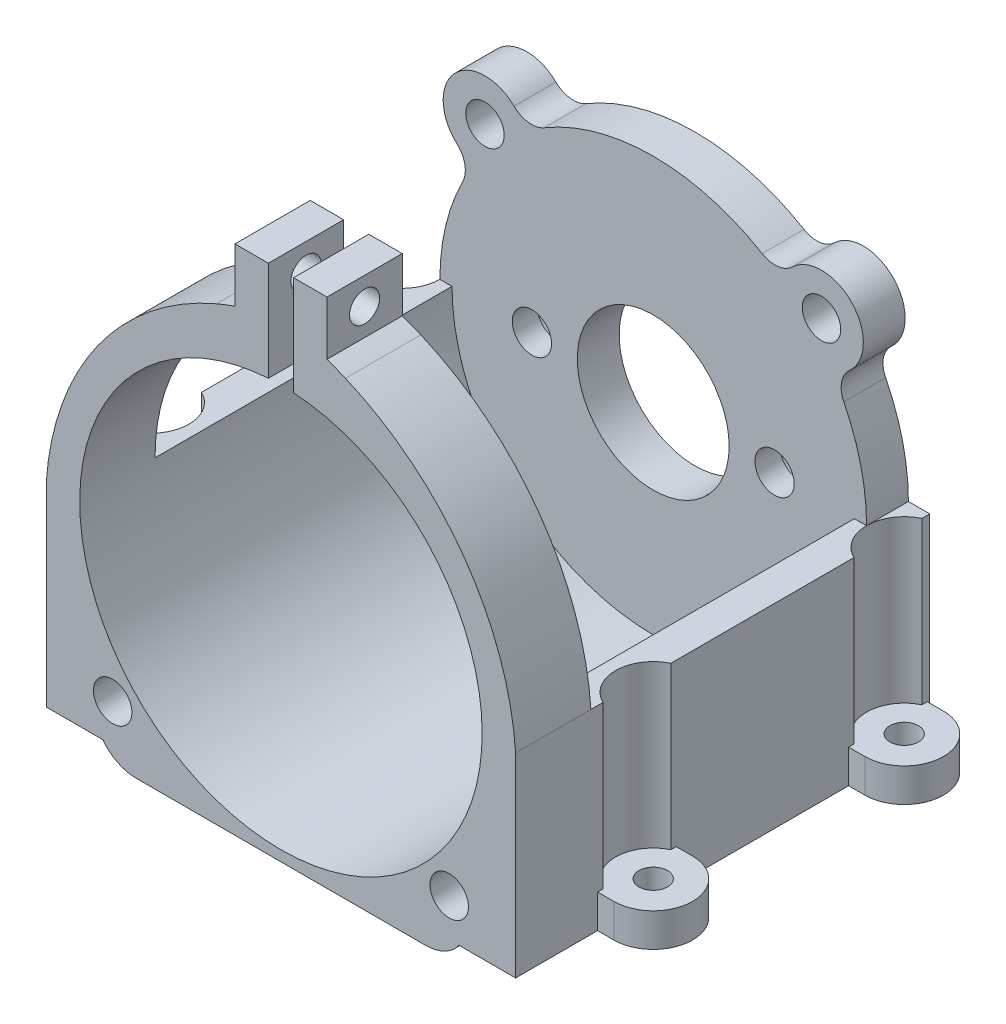
from build123d import *
from build123d.topology import SkipClean

# Parameters (mm, degrees)
SKETCH_1_R               = 2.35
SKETCH_1_R_2             = 9.075
EXTRUDE_1_DEPTH          = 5
EXTRUDE_2_DEPTH          = 44.5
EXTRUDE_2_DEPTH_BACK     = 5
EXTRUDE_START            = -9
EXTRUDE_3_DEPTH          = 9
SKETCH_5_R               = 1.8
CUT_EXTRUDE_2_DEPTH      = 19
CUT_EXTRUDE_5_DEPTH      = 10
CUT_EXTRUDE_5_DEPTH_BACK = 10
SKETCH_9_W               = 118.709111843
SKETCH_9_H               = 68.105929764
SKETCH_9_W_2             = 50.6
SKETCH_9_H_2             = 49.5
SKETCH_10_W              = 50.6
SKETCH_10_H              = 4.95
CUT_EXTRUDE_6_DEPTH      = 67.26064134
SKETCH_11_R              = 2.3
CUT_EXTRUDE_7_DEPTH      = 67.26064134
SKETCH_12_R              = 2.3
CUT_EXTRUDE_8_DEPTH      = 10
SKETCH_13_R              = 4.5
CUT_EXTRUDE_9_DEPTH      = 2
SKETCH_14_R              = 1.7
EXTRUDE_4_DEPTH          = 4
CUT_EXTRUDE_10_REACH     = 72.316
SKETCH_15_R              = 24.05
EXTRUDE_5_REACH          = 72.316
SKETCH_17_R              = 2.3
EXTRUDE_6_DEPTH          = 9
SKETCH_19_R              = 4.5
CUT_EXTRUDE_11_DEPTH     = 82.872873798
EXTRUDE_7_DEPTH          = 5
FILLET_2_R               = 5


with BuildPart() as part:
    # Эскиз1 → Бобышка-Вытянуть1 (new body)
    with BuildSketch(Plane.XY):
        with BuildLine():
            ThreePointArc((-13.019103812, -21.9260789), (-14.899244328, -21.525926197), (-16.636311976, -22.349119084))
            ThreePointArc((-16.636311976, -22.349119084), (-23.768995303, -22.164946702), (-23.455168213, -15.036791017))
            ThreePointArc((-23.455168213, -15.036791017), (-22.512808868, -13.361377812), (-22.780834847, -11.457903983))
            ThreePointArc((-22.780834847, -11.457903983), (-25.5, 0), (-22.780834847, 11.457903983))
            ThreePointArc((-22.780834847, 11.457903983), (-22.512808868, 13.361377812), (-23.455168213, 15.036791017))
            ThreePointArc((-23.455168213, 15.036791017), (-23.768995303, 22.164946702), (-16.636311976, 22.349119084))
            ThreePointArc((-16.636311976, 22.349119084), (-14.899244328, 21.525926197), (-13.019103812, 21.9260789))
            ThreePointArc((-13.019103812, 21.9260789), (0, 25.5), (13.019103812, 21.9260789))
            ThreePointArc((13.019103812, 21.9260789), (14.899244328, 21.525926197), (16.636311976, 22.349119084))
            ThreePointArc((16.636311976, 22.349119084), (23.768995303, 22.164946702), (23.455168213, 15.036791017))
            ThreePointArc((23.455168213, 15.036791017), (22.512808868, 13.361377812), (22.780834847, 11.457903983))
            ThreePointArc((22.780834847, 11.457903983), (25.5, 0), (22.780834847, -11.457903983))
            ThreePointArc((22.780834847, -11.457903983), (22.512808868, -13.361377812), (23.455168213, -15.036791017))
            ThreePointArc((23.455168213, -15.036791017), (23.768995303, -22.164946702), (16.636311976, -22.349119084))
            ThreePointArc((16.636311976, -22.349119084), (14.899244328, -21.525926197), (13.019103812, -21.9260789))
            ThreePointArc((13.019103812, -21.9260789), (0, -25.5), (-13.019103812, -21.9260789))
        make_face()
        with Locations((-14.5, 0)):
            Circle(SKETCH_1_R, mode=Mode.SUBTRACT)
        with Locations((14.5, 0)):
            Circle(SKETCH_1_R, mode=Mode.SUBTRACT)
        Circle(SKETCH_1_R_2, mode=Mode.SUBTRACT)
    extrude(amount=EXTRUDE_1_DEPTH)

    # Эскиз2 → Бобышка-Вытянуть2 (add, two sides: drawn at the far end of the back side and taken through both)
    with BuildSketch(Plane.XY.offset(5).offset(-EXTRUDE_2_DEPTH_BACK)):
        with BuildLine():
            Line((-25.3, 0), (-21.3, 0))
            ThreePointArc((-21.3, 0), (0, -21.3), (21.3, 0))
            Line((21.3, 0), (25.3, 0))
            Line((25.3, 0), (25.3, -13.25))
            ThreePointArc((25.3, -13.25), (28.228932188, -20.321067812), (35.3, -23.25))
            Line((35.3, -23.25), (50, -23.25))
            Line((50, -23.25), (50, -28.25))
            Line((50, -28.25), (-50, -28.25))
            Line((-50, -28.25), (-50, -23.25))
            Line((-50, -23.25), (-35.3, -23.25))
            ThreePointArc((-35.3, -23.25), (-28.228932188, -20.321067812), (-25.3, -13.25))
            Line((-25.3, -13.25), (-25.3, 0))
        make_face()
    extrude(amount=EXTRUDE_2_DEPTH + EXTRUDE_2_DEPTH_BACK)

    # Эскиз4 → Бобышка-Вытянуть3 (add)
    with SkipClean():  # the faces are left unmerged after this step: merging them gives an invalid solid
        with BuildSketch(Plane.XY.offset(49.5).offset(EXTRUDE_START)):
            with BuildLine():
                Line((21.3, 0), (25.3, 0))
                ThreePointArc((25.3, 0), (20.373090978, 18.07450089), (5.5, 29.465426213))
                Line((5.5, 29.465426213), (5.5, 35.916188423))
                Line((5.5, 35.916188423), (1.5, 35.916188423))
                Line((1.5, 35.916188423), (1.5, 29.916188423))
                Line((1.5, 29.916188423), (1.5, 21.247117452))
                ThreePointArc((1.5, 21.247117452), (15.582682696, 14.521363572), (21.3, 0))
            make_face()
            with BuildLine():
                Line((-25.3, 0), (-21.3, 0))
                ThreePointArc((-21.3, 0), (-15.582682696, 14.521363572), (-1.5, 21.247117452))
                Line((-1.5, 21.247117452), (-1.5, 29.916188423))
                Line((-1.5, 29.916188423), (-1.5, 35.916188423))
                Line((-1.5, 35.916188423), (-5.5, 35.916188423))
                Line((-5.5, 35.916188423), (-5.5, 29.465426213))
                ThreePointArc((-5.5, 29.465426213), (-20.373090978, 18.07450089), (-25.3, 0))
            make_face()
        extrude(amount=EXTRUDE_3_DEPTH)

    # Эскиз5 → Вырез-Вытянуть2 (cut)
    with SkipClean():  # the faces are left unmerged after this step: merging them gives an invalid solid
        with BuildSketch(Plane.ZY.offset(5.5)):
            with Locations(Location((45, 32.690807318, 0), (0, 0, 270))):
                Circle(SKETCH_5_R)
        extrude(amount=-CUT_EXTRUDE_2_DEPTH, mode=Mode.SUBTRACT)

    # Эскиз9 → Вырез-Вытянуть5 (cut, two sides: drawn at the far end of the back side and taken through both)
    with SkipClean():  # the faces are left unmerged after this step: merging them gives an invalid solid
        with BuildSketch(Plane(origin=(0, -23.25, 0), x_dir=(1, 0, 0), z_dir=(0, 1, 0)).offset(-CUT_EXTRUDE_5_DEPTH_BACK)):
            with Locations((-0.535798399, -23.678403203)):
                Rectangle(SKETCH_9_W, SKETCH_9_H)
            with Locations((0, -24.75)):
                Rectangle(SKETCH_9_W_2, SKETCH_9_H_2, mode=Mode.SUBTRACT)
        extrude(amount=CUT_EXTRUDE_5_DEPTH + CUT_EXTRUDE_5_DEPTH_BACK, mode=Mode.SUBTRACT)

    # Эскиз10 → Вырез-Вытянуть6 (cut, through all)
    with SkipClean():  # the faces are left unmerged after this step: merging them gives an invalid solid
        with BuildSketch(Plane.XY.offset(49.5)):
            with Locations((0, -25.775)):
                Rectangle(SKETCH_10_W, SKETCH_10_H)
        extrude(amount=-CUT_EXTRUDE_6_DEPTH, mode=Mode.SUBTRACT)

    # Эскиз11 → Вырез-Вытянуть7 (cut, through all)
    with SkipClean():  # the faces are left unmerged after this step: merging them gives an invalid solid
        with BuildSketch(Plane(origin=(0, 0, 0), x_dir=(-1, 0, 0), z_dir=(0, 0, -1))):
            with Locations((-20.112226795, -18.754954902)):
                Circle(SKETCH_11_R)
            with Locations((20.112226795, -18.754954902)):
                Circle(SKETCH_11_R)
        extrude(amount=-CUT_EXTRUDE_7_DEPTH, mode=Mode.SUBTRACT)

    # Эскиз12 → Вырез-Вытянуть8 (cut)
    with SkipClean():  # the faces are left unmerged after this step: merging them gives an invalid solid
        with BuildSketch(Plane(origin=(0, 0, 0), x_dir=(-1, 0, 0), z_dir=(0, 0, -1))):
            with Locations((-20.112226795, 18.754954902)):
                Circle(SKETCH_12_R)
            with Locations((20.112226795, 18.754954902)):
                Circle(SKETCH_12_R)
        extrude(amount=-CUT_EXTRUDE_8_DEPTH, mode=Mode.SUBTRACT)

    # Эскиз13 → Вырез-Вытянуть9 (cut)
    with SkipClean():  # the faces are left unmerged after this step: merging them gives an invalid solid
        with BuildSketch(Plane(origin=(0, 0, 0), x_dir=(-1, 0, 0), z_dir=(0, 0, -1))):
            with Locations((-14.5, 0)):
                Circle(SKETCH_13_R)
            with Locations((14.5, 0)):
                Circle(SKETCH_13_R)
        extrude(amount=-CUT_EXTRUDE_9_DEPTH, mode=Mode.SUBTRACT)

    # Эскиз14 → Бобышка-Вытянуть4 (add)
    # profile 1 of 4: a face of its own
    with SkipClean():  # the faces are left unmerged after this step: merging them gives an invalid solid
        with BuildSketch(Plane.XZ.offset(23.3)):
            with BuildLine():
                Line((-30, 39.7), (-25.3, 39.7))
                Line((-25.3, 39.7), (-25.3, 30.3))
                Line((-25.3, 30.3), (-30, 30.3))
                ThreePointArc((-30, 30.3), (-34.7, 35), (-30, 39.7))
            make_face()
            with Locations(Location((-30, 35, 0), (0, 0, 270))):
                Circle(SKETCH_14_R, mode=Mode.SUBTRACT)
        # profile 2 of 4: a face of its own
        with BuildSketch(Plane.XZ.offset(23.3)):
            with BuildLine():
                Line((25.3, 39.7), (25.3, 30.3))
                Line((25.3, 30.3), (30, 30.3))
                ThreePointArc((30, 30.3), (34.7, 35), (30, 39.7))
                Line((30, 39.7), (25.3, 39.7))
            make_face()
            with Locations(Location((30, 35, 0), (0, 0, 90))):
                Circle(SKETCH_14_R, mode=Mode.SUBTRACT)
        # profile 3 of 4: a face of its own
        with BuildSketch(Plane.XZ.offset(23.3)):
            with BuildLine():
                Line((30, 0.3), (25.3, 0.3))
                Line((25.3, 0.3), (25.3, 9.7))
                Line((25.3, 9.7), (30, 9.7))
                ThreePointArc((30, 9.7), (34.7, 5), (30, 0.3))
            make_face()
            with Locations(Location((30, 5, 0), (0, 0, 270))):
                Circle(SKETCH_14_R, mode=Mode.SUBTRACT)
        # profile 4 of 4: a face of its own
        with BuildSketch(Plane.XZ.offset(23.3)):
            with BuildLine():
                Line((-25.3, 0.3), (-25.3, 9.7))
                Line((-25.3, 9.7), (-30, 9.7))
                ThreePointArc((-30, 9.7), (-34.7, 5), (-30, 0.3))
                Line((-30, 0.3), (-25.3, 0.3))
            make_face()
            with Locations(Location((-30, 5, 0), (0, 0, 90))):
                Circle(SKETCH_14_R, mode=Mode.SUBTRACT)
        extrude(amount=-EXTRUDE_4_DEPTH)

    # Вырез-Вытянуть10: up to this face of the body (flat: up to its plane)
    cut_extrude_10_end = Plane(part.part.faces().sort_by_distance((24.448756795, 4.205453076, 5))[0])
    # Эскиз15 → Вырез-Вытянуть10 (cut, up to the picked face)
    with BuildSketch(Plane.XY.offset(49.5), mode=Mode.PRIVATE) as cut_extrude_10_sk1:
        Circle(SKETCH_15_R)
    cut_extrude_10_tool1 = split(extrude(cut_extrude_10_sk1.sketch, amount=-CUT_EXTRUDE_10_REACH, mode=Mode.PRIVATE), bisect_by=cut_extrude_10_end, keep=Keep.BOTH, mode=Mode.PRIVATE)
    add(cut_extrude_10_tool1.solids().sort_by(Axis((0, 0, 49.5), (0, 0, -1)))[0], mode=Mode.SUBTRACT)

    # Бобышка-Вытянуть5: up to this face of the body (flat: up to its plane)
    extrude_5_end = Plane(part.part.faces().sort_by_distance((-24.435278563, 4.203134673, 0))[0])
    # Эскиз17 → Бобышка-Вытянуть5 (add, up to the picked face)
    with BuildSketch(Plane.XY.offset(49.5), mode=Mode.PRIVATE) as extrude_5_sk1:
        with BuildLine():
            Line((24.05, 0), (28.05, 0))
            Line((28.05, 0), (28.05, -23.3))
            Line((28.05, -23.3), (21.3, -23.3))
            Line((21.3, -23.3), (21.3, -25.3))
            Line((21.3, -25.3), (-21.3, -25.3))
            Line((-21.3, -25.3), (-21.3, -23.3))
            Line((-21.3, -23.3), (-28.05, -23.3))
            Line((-28.05, -23.3), (-28.05, 0))
            Line((-28.05, 0), (-24.05, 0))
            ThreePointArc((-24.05, 0), (0, -24.05), (24.05, 0))
        make_face()
        with Locations(Location((20.112226795, -18.754954902, 0), (0, 0, 180))):
            Circle(SKETCH_17_R, mode=Mode.SUBTRACT)
        with Locations(Location((-20.112226795, -18.754954902, 0), (0, 0, 180))):
            Circle(SKETCH_17_R, mode=Mode.SUBTRACT)
    extrude_5_tool1 = split(extrude(extrude_5_sk1.sketch, amount=-EXTRUDE_5_REACH, mode=Mode.PRIVATE), bisect_by=extrude_5_end, keep=Keep.BOTH, mode=Mode.PRIVATE)
    add(extrude_5_tool1.solids().sort_by(Axis((26.05, -0.61541, 49.5), (0, 0, -1)))[0])

    # Эскиз18 → Бобышка-Вытянуть6 (add)
    with BuildSketch(Plane.XY.offset(49.5)):
        with BuildLine():
            Line((-24.05, 0), (-28.05, 0))
            ThreePointArc((-28.05, 0), (-21.205828195, 18.123642363), (-5.5, 29.465426213))
            Line((-5.5, 29.465426213), (-1.5, 24.003176873))
            ThreePointArc((-1.5, 24.003176873), (-17.528227235, 16.467050434), (-24.05, 0))
        make_face()
        with BuildLine():
            Line((5.5, 29.465426213), (1.5, 24.003176873))
            ThreePointArc((1.5, 24.003176873), (17.528227235, 16.467050434), (24.05, 0))
            Line((24.05, 0), (28.05, 0))
            ThreePointArc((28.05, 0), (21.205828195, 18.123642363), (5.5, 29.465426213))
        make_face()
    extrude(amount=-EXTRUDE_6_DEPTH)

    # Эскиз19 → Вырез-Вытянуть11 (cut, through all)
    with BuildSketch(Plane(origin=(0, -19.3, 0), x_dir=(1, 0, 0), z_dir=(0, 1, 0))):
        with Locations((30, -5)):
            Circle(SKETCH_19_R)
        with Locations((30, -35)):
            Circle(SKETCH_19_R)
        with Locations((-30, -35)):
            Circle(SKETCH_19_R)
        with Locations((-30, -5)):
            Circle(SKETCH_19_R)
    extrude(amount=CUT_EXTRUDE_11_DEPTH, mode=Mode.SUBTRACT)

    # Эскиз20 → Бобышка-Вытянуть7 (add)
    with BuildSketch(Plane.XY.offset(5)):
        with BuildLine():
            Line((-14.981750785, -18.813549464), (15.898564469, -18.045446734))
            ThreePointArc((15.898564469, -18.045446734), (0.598023648, -24.042563668), (-14.981750785, -18.813549464))
        make_face()
    extrude(amount=-EXTRUDE_7_DEPTH)

    # Скругление2
    # the kernel refuses this fillet: 5 mm, written as the material it takes off along each edge
    with BuildSketch(Plane(origin=(21.3, -25.3, 59.5), x_dir=(-1, 0, 0), z_dir=(0, 0, -1))) as fillet_2_piece_1:
        with BuildLine():
            CenterArc((4, 5), FILLET_2_R, 216.869897646, 53.130102354)
            Line((0, 2), (-0.08, 1.94))
            ThreePointArc((-0.08, 1.94), (-0.1, 1), (-0.1, 0))
            Line((-0.1, 0), (0, -0.1))
            Line((0, -0.1), (4, -0.1))
            Line((4, -0.1), (4, 0))
        make_face()
    extrude(amount=69.5, mode=Mode.SUBTRACT)
    with BuildSketch(Plane(origin=(-21.3, -25.3, 59.5), x_dir=(0, 1, 0), z_dir=(0, 0, -1))) as fillet_2_piece_2:
        with BuildLine():
            CenterArc((5, 4), FILLET_2_R, 180, 53.130102354)
            Line((0, 4), (-0.1, 4))
            Line((-0.1, 4), (-0.1, 0))
            Line((-0.1, 0), (0, -0.1))
            ThreePointArc((0, -0.1), (1, -0.1), (1.94, -0.08))
            Line((1.94, -0.08), (2, 0))
        make_face()
    extrude(amount=69.5, mode=Mode.SUBTRACT)


solid = part.part
